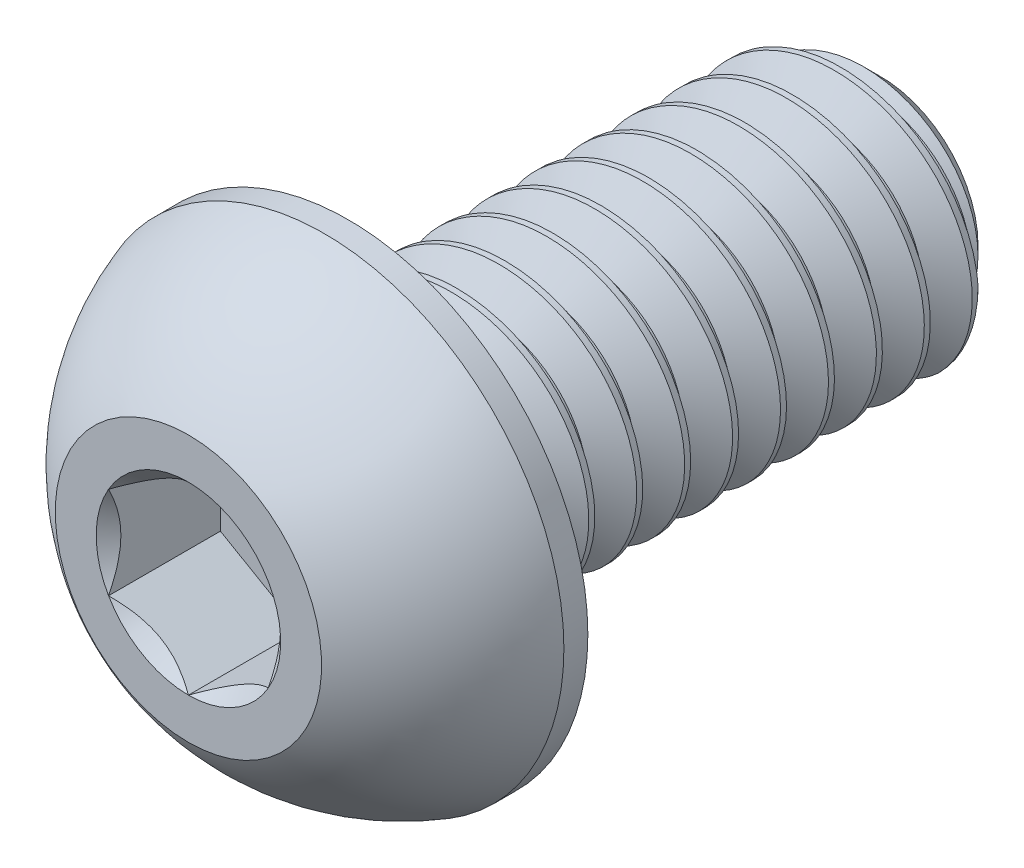
from build123d import *

# Parameters (mm, degrees)
CUT_EXTRUDE2_DEPTH = 1.05
CUT_SWEEP2_PITCH   = 0.45


# Read off the part's stored shape, not the designer's step: Split1
with BuildPart() as part:
    # Sketch10 → Revolve3 (revolve)
    with BuildSketch(Plane(origin=(0, 0, 0), x_dir=(0, 0, -1), z_dir=(1, 0, 0)), mode=Mode.PRIVATE) as revolve3_sk:
        Polygon((6.1625, 1.25), (6.5, 0.9125), (6.5, 0), (1.5, 0), (1.5, 1.25), align=None)
    revolve(revolve3_sk.sketch.rotate(Axis((0, 0, 0), (0, 0, -1)), 90), axis=Axis((0, 0, 0), (0, 0, -1)))

    # Sketch7 → Revolve2 (revolve)
    with BuildSketch(Plane(origin=(0, 0, 0), x_dir=(0, 0, -1), z_dir=(1, 0, 0)), mode=Mode.PRIVATE) as revolve2_sk:
        with BuildLine():
            Line((1.275, 2.25), (1.5, 2.25))
            Line((1.5, 2.25), (1.5, 0))
            Line((1.5, 0), (0, 0))
            Line((0, 0), (0, 1.25))
            ThreePointArc((0, 1.25), (0.549264706, 1.8625), (1.275, 2.25))
        make_face()
    revolve(revolve2_sk.sketch.rotate(Axis((0, 0, 0), (0, 0, -1)), 180), axis=Axis((0, 0, 0), (0, 0, -1)))

    # Sketch5 → Cut-Extrude2 (cut)
    with BuildSketch(Plane.XY):
        Polygon((0.75, -0.433012702), (0.75, 0.433012702), (0, 0.866025404), (-0.75, 0.433012702), (-0.75, -0.433012702), (0, -0.866025404), align=None)
    extrude(amount=-CUT_EXTRUDE2_DEPTH, mode=Mode.SUBTRACT)

    # Cut-Extrude3 cone 1 section (through the dimple's axis) → Cut-Extrude3 (revolve, cut)
    with BuildSketch(Plane(origin=(0, 0, 0), x_dir=(0, -1, 0), z_dir=(1, 0, 0))):
        Polygon((0, 0), (0.866025404, 0), (0, 0.866025404), align=None)
    revolve(axis=Axis((0, 0, 0), (0, 0, -1)), mode=Mode.SUBTRACT)


with BuildPart() as body_2:
    # Split1: the piece on the far side of the plane
    add(part.part)
    split(bisect_by=Plane.XY.offset(-1.5), keep=Keep.BOTTOM)

    # Cut-Sweep2: the profile of Sketch12 screwed along a right-hand helix of 14.444444 turns, 6 arcs to a turn; built about Z, then put on its axis
    cut_sweep2_z = Axis((0, 0, 0), (0, 0, 1))
    cut_sweep2_corners = [(0.957716426, 0, -0.16875), (0.957716426, 0, -0.225), (1.274356964, 0, -0.4078125), (1.274356964, 0, 0.0140625)]
    with BuildLine(mode=Mode.PRIVATE) as cut_sweep2_profile:
        Line(cut_sweep2_corners[0], cut_sweep2_corners[1])
        Line(cut_sweep2_corners[1], cut_sweep2_corners[2])
        Line(cut_sweep2_corners[2], cut_sweep2_corners[3])
        Line(cut_sweep2_corners[3], cut_sweep2_corners[0])
    cut_sweep2_cap = Face(cut_sweep2_profile.wire())
    cut_sweep2_turn_angles = [0, 30, 60, 90, 120, 150, 180, 210, 240, 270, 300, 330, 360]
    cut_sweep2_turn_weights = [1, 0.8660254037844387, 1, 0.8660254037844387, 1, 0.8660254037844387, 1, 0.8660254037844387, 1, 0.8660254037844387, 1, 0.8660254037844387, 1]
    cut_sweep2_turn_rails = [Edge.make_bspline([Vector(p[0], p[1], 0).rotate(cut_sweep2_z, cut_sweep2_turn_angles[k]) / cut_sweep2_turn_weights[k] + Vector(0, 0, p[2] + CUT_SWEEP2_PITCH * cut_sweep2_turn_angles[k] / 360) for k in range(13)], [0, 0, 0, 1, 1, 2, 2, 3, 3, 4, 4, 5, 5, 6, 6, 6], 2, cut_sweep2_turn_weights) for p in cut_sweep2_corners]
    cut_sweep2_turn_sides = [Face.make_surface_from_curves(cut_sweep2_turn_rails[p[0]], cut_sweep2_turn_rails[p[1]]) for p in [(0, 1), (1, 2), (2, 3), (3, 0)]]
    cut_sweep2_turn = Solid(Shell([*cut_sweep2_turn_sides, cut_sweep2_cap, cut_sweep2_cap.rotate(cut_sweep2_z, 360).moved(Location((0, 0, CUT_SWEEP2_PITCH * 360 / 360)))]))
    cut_sweep2_last_angles = [5040, 5070, 5100, 5130, 5160, 5180, 5200]
    cut_sweep2_last_weights = [1, 0.8660254037844387, 1, 0.8660254037844387, 1, 0.9396926207858731, 1]
    cut_sweep2_last_rails = [Edge.make_bspline([Vector(p[0], p[1], 0).rotate(cut_sweep2_z, cut_sweep2_last_angles[k]) / cut_sweep2_last_weights[k] + Vector(0, 0, p[2] + CUT_SWEEP2_PITCH * cut_sweep2_last_angles[k] / 360) for k in range(7)], [0, 0, 0, 1, 1, 2, 2, 3, 3, 3], 2, cut_sweep2_last_weights) for p in cut_sweep2_corners]
    cut_sweep2_last_sides = [Face.make_surface_from_curves(cut_sweep2_last_rails[p[0]], cut_sweep2_last_rails[p[1]]) for p in [(0, 1), (1, 2), (2, 3), (3, 0)]]
    cut_sweep2_last = Solid(Shell([*cut_sweep2_last_sides, cut_sweep2_cap.rotate(cut_sweep2_z, 5040).moved(Location((0, 0, CUT_SWEEP2_PITCH * 5040 / 360))), cut_sweep2_cap.rotate(cut_sweep2_z, 5200).moved(Location((0, 0, CUT_SWEEP2_PITCH * 5200 / 360)))]))
    cut_sweep2_each = [*[cut_sweep2_turn.moved(Location((0, 0, CUT_SWEEP2_PITCH * i))) for i in range(14)], cut_sweep2_last]
    add(Plane(origin=(0, 0, -6.5), x_dir=(0, 1, 0), z_dir=(0, 0, 1)) * Compound([cut_sweep2_each[i] for i in range(0, 15, 2)]), mode=Mode.SUBTRACT)
    add(Plane(origin=(0, 0, -6.5), x_dir=(0, 1, 0), z_dir=(0, 0, 1)) * Compound([cut_sweep2_each[i] for i in range(1, 15, 2)]), mode=Mode.SUBTRACT)


with BuildPart() as part_1:
    add(part.part)

    # Split1
    split(bisect_by=Plane.XY.offset(-1.5), keep=Keep.TOP)

    add(body_2.part)  # Boss-Extrude1 merges body 2
    # Boss-Extrude1 cone 1 section (through the dimple's axis) → Boss-Extrude1 (revolve)
    with BuildSketch(Plane(origin=(0, 0, -1.5), x_dir=(0, -1, 0), z_dir=(1, 0, 0))):
        Polygon((0, 0), (1.25, 0), (0, 1.25), align=None)
    revolve(axis=Axis((0, 0, -1.5), (0, 0, -1)))


solid = part_1.part
